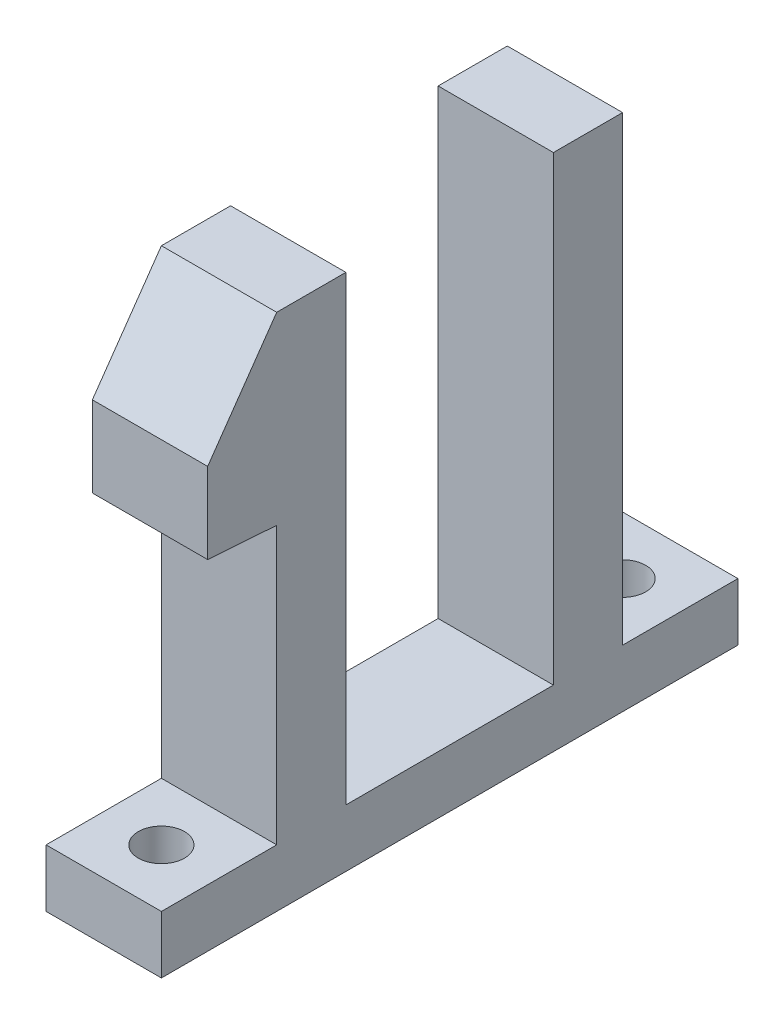
from build123d import *

# Parameters (mm, degrees)
SKETCH_1_W          = 5
SKETCH_1_H          = 25
SKETCH_1_R          = 1
EXTRUDE_1_DEPTH     = 2.5
SKETCH_3_W          = 5
SKETCH_3_H          = 15
EXTRUDE_2_DEPTH     = 20
SKETCH_6_W          = 9
SKETCH_6_H          = 20
CUT_EXTRUDE_1_DEPTH = 27.220221204
EXTRUDE_3_DEPTH     = 5


with BuildPart() as part:
    # 草图1 → 凸台-拉伸1 (new body)
    with BuildSketch(Plane(origin=(0, 0, 0), x_dir=(1, 0, 0), z_dir=(0, 1, 0))):
        Rectangle(SKETCH_1_W, SKETCH_1_H)
        with Locations((0, 10)):
            Circle(SKETCH_1_R, mode=Mode.SUBTRACT)
        with Locations((0, -10)):
            Circle(SKETCH_1_R, mode=Mode.SUBTRACT)
    extrude(amount=EXTRUDE_1_DEPTH)

    # 草图3 → 凸台-拉伸2 (add)
    with BuildSketch(Plane(origin=(0, 2.5, 0), x_dir=(1, 0, 0), z_dir=(0, 1, 0))):
        Rectangle(SKETCH_3_W, SKETCH_3_H)
    extrude(amount=EXTRUDE_2_DEPTH)

    # 草图6 → 切除-拉伸1 (cut, through all)
    with BuildSketch(Plane(origin=(2.5, 0, 0), x_dir=(0, 0, -1), z_dir=(1, 0, 0))):
        with Locations((0, 12.5)):
            Rectangle(SKETCH_6_W, SKETCH_6_H)
    extrude(amount=-CUT_EXTRUDE_1_DEPTH, mode=Mode.SUBTRACT)

    # 草图5 → 凸台-拉伸3 (add)
    with BuildSketch(Plane(origin=(2.5, 0, 0), x_dir=(0, 0, -1), z_dir=(1, 0, 0))):
        Polygon((-7.5, 14.5), (-10.492692151, 14.709269421), (-10.492692151, 18.209269421), (-7.5, 22.5), align=None)
    extrude(amount=-EXTRUDE_3_DEPTH)


solid = part.part
